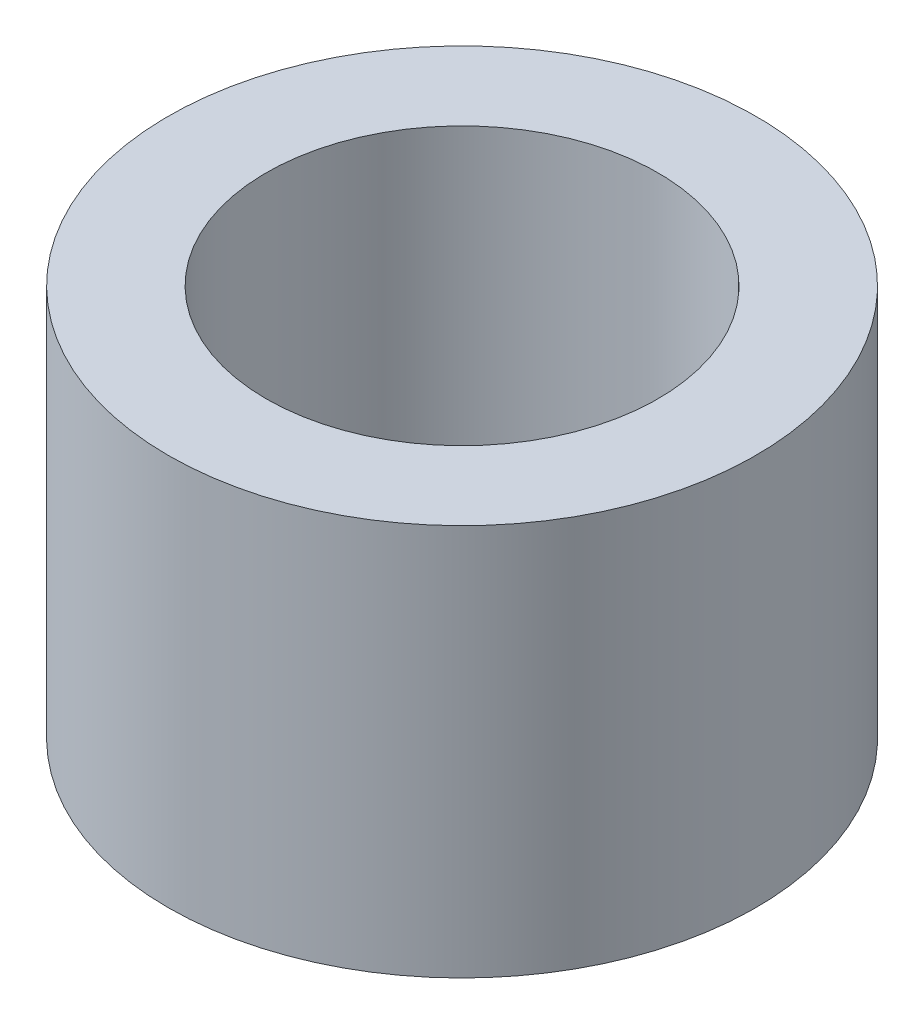
from build123d import *

# Parameters (mm, degrees)
SKETCH_1_R      = 6
SKETCH_1_R_2    = 4
EXTRUDE_1_DEPTH = 8


with BuildPart() as part:
    # Эскиз1 → Бобышка-Вытянуть1 (new body)
    with BuildSketch(Plane(origin=(0, 0, 0), x_dir=(1, 0, 0), z_dir=(0, 1, 0))):
        Circle(SKETCH_1_R)
        Circle(SKETCH_1_R_2, mode=Mode.SUBTRACT)
    extrude(amount=EXTRUDE_1_DEPTH)


solid = part.part
